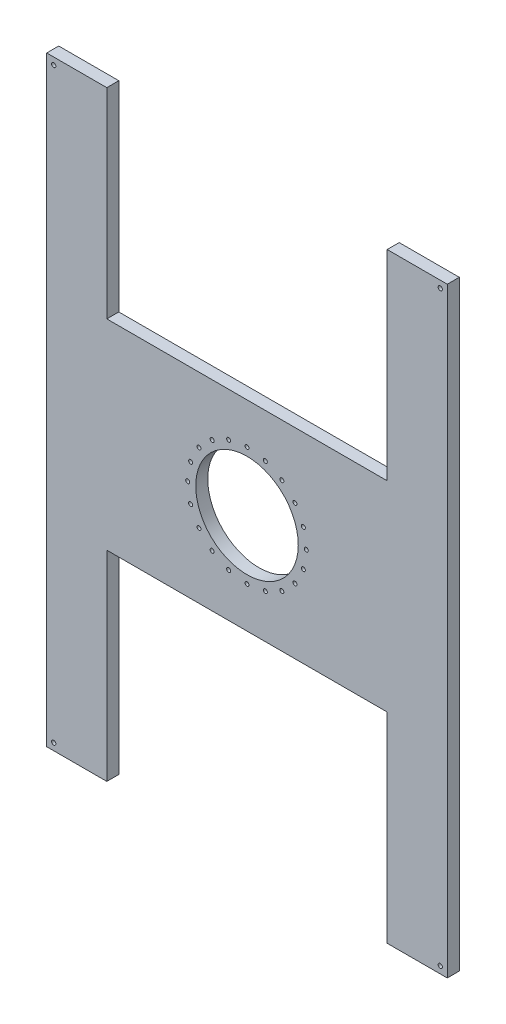
from build123d import *

# Parameters (mm, degrees)
BOSS_EXTRU_1_DEPTH           = 60
ESQUISSE2_R                  = 256
ENL_V_MAT_EXTRU_1_DEPTH      = 2237.872817127
ESQUISSE5_R                  = 10
ENL_V_MAT_EXTRU_3_DEPTH      = 2237.872817127
R_P_TITION_CIRCULAIRE1_COUNT = 20
ESQUISSE6_R                  = 10.5
ENL_V_MAT_EXTRU_4_DEPTH      = 2237.872817127


with BuildPart() as part:
    # Esquisse1 → Boss.-Extru.1 (new body)
    with BuildSketch(Plane.XY):
        Polygon((-1000, 2000), (-700, 2000), (-700, 1000), (700, 1000), (700, 2000), (1000, 2000), (1000, -1000), (700, -1000), (700, 0), (-700, 0), (-700, -1000), (-1000, -1000), align=None)
    extrude(amount=BOSS_EXTRU_1_DEPTH)

    # Esquisse2 → Enlèv. mat.-Extru.1 (cut, through all)
    with BuildSketch(Plane.XY.offset(60)):
        with Locations((0, 500)):
            Circle(ESQUISSE2_R)
    extrude(amount=-ENL_V_MAT_EXTRU_1_DEPTH, mode=Mode.SUBTRACT)

    # Esquisse5 → Enlèv. mat.-Extru.3 (cut, through all)
    with BuildSketch(Plane.XY):
        with Locations((0, 796)):
            Circle(ESQUISSE5_R)
    enl_v_mat_extru_3 = extrude(amount=ENL_V_MAT_EXTRU_3_DEPTH, mode=Mode.SUBTRACT)

    # Répétition circulaire1: Enlèv. mat.-Extru.3 ×20 about axis
    r_p_tition_circulaire1_axis = Axis((0, 500, 0), (0, 0, -1))
    for i in range(1, R_P_TITION_CIRCULAIRE1_COUNT):
        add(enl_v_mat_extru_3.rotate(r_p_tition_circulaire1_axis, i * 360 / R_P_TITION_CIRCULAIRE1_COUNT), mode=Mode.SUBTRACT)

    # Esquisse6 → Enlèv. mat.-Extru.4 (cut, through all)
    with BuildSketch(Plane(origin=(0, 0, 0), x_dir=(-1, 0, 0), z_dir=(0, 0, -1))):
        with Locations((-965, 1965)):
            Circle(ESQUISSE6_R)
        with Locations((-965, -965)):
            Circle(ESQUISSE6_R)
        with Locations((965, -965)):
            Circle(ESQUISSE6_R)
        with Locations((965, 1965)):
            Circle(ESQUISSE6_R)
    extrude(amount=-ENL_V_MAT_EXTRU_4_DEPTH, mode=Mode.SUBTRACT)


solid = part.part
